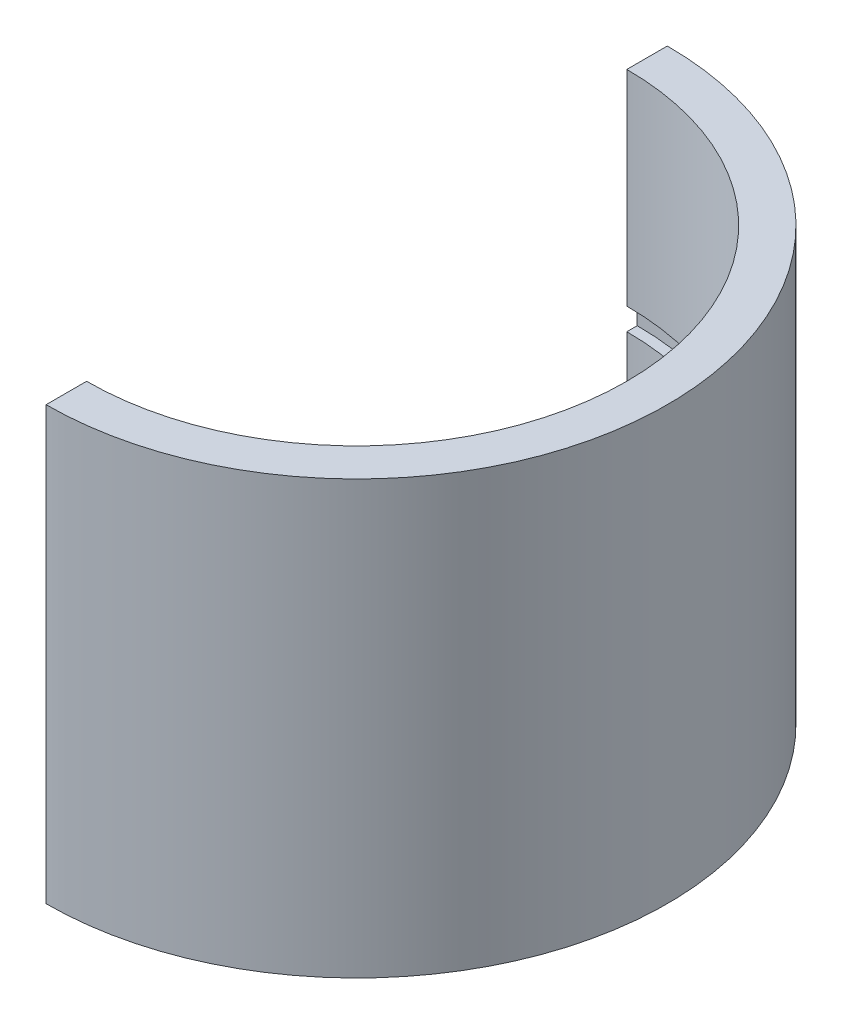
from build123d import *

# Parameters (mm, degrees)
BOSS_EXTRUDE1_DEPTH       = 19
CUT_REVOLVE_THIN4_START   = 9.090052714
CUT_REVOLVE_THIN4_DEPTH   = 0.819894572
CUT_REVOLVE_THIN4_START_2 = 9.100052714
CUT_REVOLVE_THIN4_2_DEPTH = 0.799894572
CUT_EXTRUDE1_DEPTH        = 1.5
CUT_EXTRUDE2_START        = -1.5
CUT_EXTRUDE2_DEPTH        = 1.5


with BuildPart() as part:
    # Sketch1 → Boss-Extrude1 (new body)
    with BuildSketch(Plane(origin=(0, 0, 0), x_dir=(1, 0, 0), z_dir=(0, 1, 0))):
        with BuildLine():
            Line((0, -10), (0, -11.5))
            ThreePointArc((0, -11.5), (8.131727984, -8.131727984), (11.5, 0))
            ThreePointArc((11.5, 0), (8.131727984, 8.131727984), (0, 11.5))
            Line((0, 11.5), (0, 10))
            ThreePointArc((0, 10), (7.071067812, 7.071067812), (10, 0))
            ThreePointArc((10, 0), (7.071067812, -7.071067812), (0, -10))
        make_face()
    extrude(amount=BOSS_EXTRUDE1_DEPTH)

    # Cut-Revolve-Thin4: read off the stored shape, not the designer's step
    # Cut-Revolve-Thin4 outline → Cut-Revolve-Thin4 (cut)
    with BuildSketch(Plane(origin=(0, 0, 0), x_dir=(1, 0, 0), z_dir=(0, 1, 0)).offset(CUT_REVOLVE_THIN4_START)):
        with BuildLine():
            ThreePointArc((0, -10.385), (10.385, 0), (0, 10.385))
            Line((0, 10.385), (0, 10))
            ThreePointArc((0, 10), (10, 0), (0, -10))
            Line((0, -10), (0, -10.385))
        make_face()
    extrude(amount=CUT_REVOLVE_THIN4_DEPTH, mode=Mode.SUBTRACT)

    # Sketch3 → Cut-Extrude1 (cut)
    with BuildSketch(Plane.XZ):
        with BuildLine():
            Line((0, 11.5), (0, 10))
            ThreePointArc((0, 10), (10, 0), (0, -10))
            Line((0, -10), (0, -11.5))
            ThreePointArc((0, -11.5), (11.5, 0), (0, 11.5))
        make_face()
    extrude(amount=-CUT_EXTRUDE1_DEPTH, mode=Mode.SUBTRACT)

    # Sketch4 → Cut-Extrude2 (cut)
    with BuildSketch(Plane(origin=(0, 19, 0), x_dir=(1, 0, 0), z_dir=(0, 1, 0)).offset(CUT_EXTRUDE2_START)):
        with BuildLine():
            Line((0, -10), (0, -11.5))
            ThreePointArc((0, -11.5), (11.5, 0), (0, 11.5))
            Line((0, 11.5), (0, 10))
            ThreePointArc((0, 10), (10, 0), (0, -10))
        make_face()
    extrude(amount=CUT_EXTRUDE2_DEPTH, mode=Mode.SUBTRACT)


with BuildPart() as body_2:
    # Cut-Revolve-Thin4 2 outline → Cut-Revolve-Thin4 2 (new body)
    with BuildSketch(Plane(origin=(0, 0, 0), x_dir=(1, 0, 0), z_dir=(0, 1, 0)).offset(CUT_REVOLVE_THIN4_START_2)):
        with BuildLine():
            Line((0, 10.375), (0, 10))
            ThreePointArc((0, 10), (10, 0), (0, -10))
            Line((0, -10), (0, -10.375))
            ThreePointArc((0, -10.375), (10.375, 0), (0, 10.375))
        make_face()
    extrude(amount=CUT_REVOLVE_THIN4_2_DEPTH)


solid = part.part
